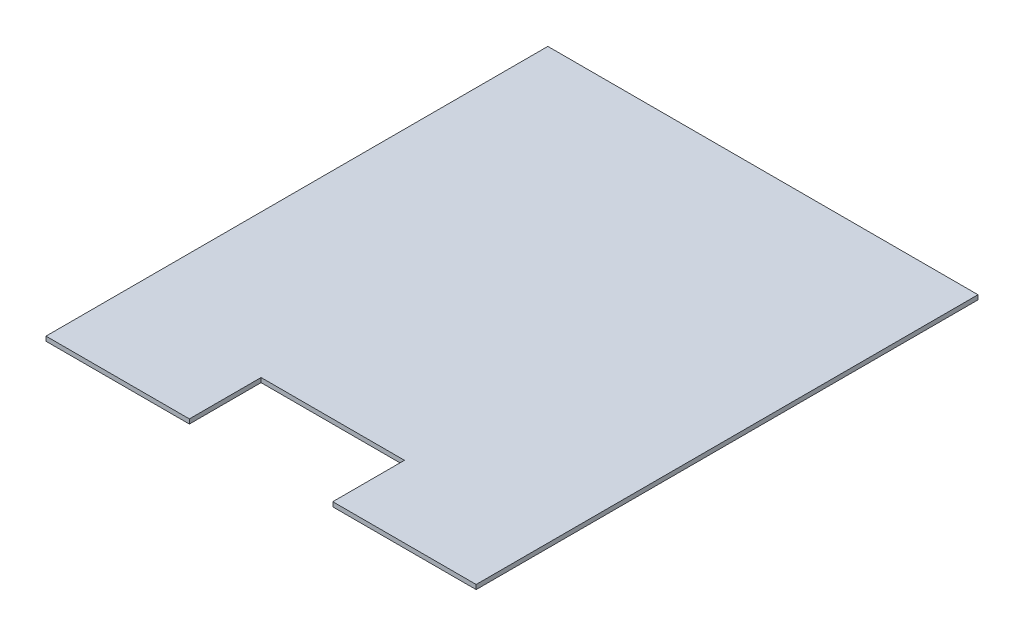
from build123d import *

# Parameters (mm, degrees)
SKETCH1_W           = 304.8
SKETCH1_H           = 355.6
BOSS_EXTRUDE1_DEPTH = 3.175
SKETCH2_W           = 101.6
SKETCH2_H           = 50.8
CUT_EXTRUDE1_DEPTH  = 3.175


with BuildPart() as part:
    # Sketch1 → Boss-Extrude1 (new body)
    with BuildSketch(Plane(origin=(0, 0, 0), x_dir=(1, 0, 0), z_dir=(0, 1, 0))):
        Rectangle(SKETCH1_W, SKETCH1_H)
    extrude(amount=BOSS_EXTRUDE1_DEPTH)

    # Sketch2 → Cut-Extrude1 (cut)
    with BuildSketch(Plane(origin=(0, 3.175, 0), x_dir=(1, 0, 0), z_dir=(0, 1, 0))):
        with Locations((0, -152.4)):
            Rectangle(SKETCH2_W, SKETCH2_H)
    extrude(amount=-CUT_EXTRUDE1_DEPTH, mode=Mode.SUBTRACT)


solid = part.part
